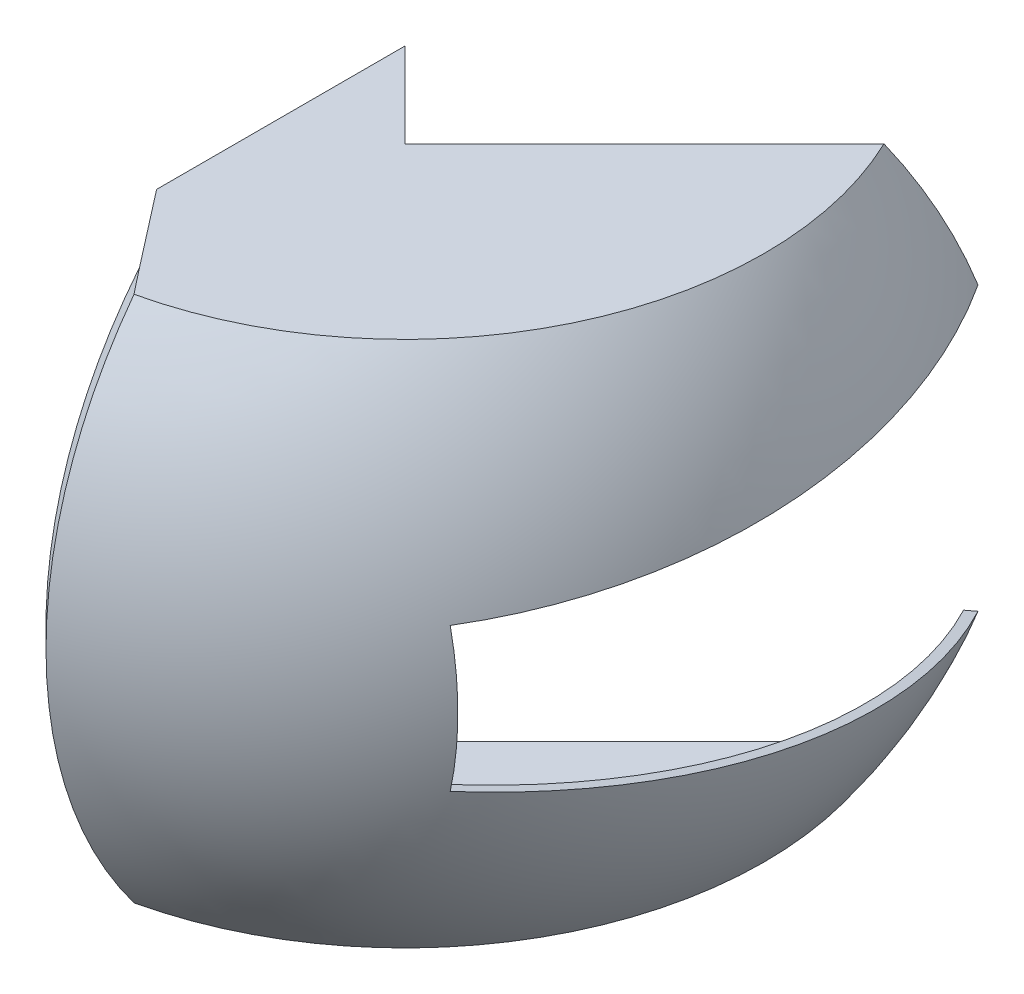
from build123d import *

# Parameters (mm, degrees)
OBR_T1_ANGLE                = 180
WYTNIJ_WYCI_GNI_CIE1_DEPTH  = 172.464281995
WYTNIJ_WYCI_GNI_CIE2_DEPTH  = 147.710676959
SFAZOWANIE1_SIZE            = 5
SKORUPA1_T                  = -2
DODANIE_WYCI_GNI_CIE1_DEPTH = 2


with BuildPart() as part:
    # Szkic1 → Obrót1 (revolve)
    with BuildSketch(Plane(origin=(0, 0, 0), x_dir=(0, 0, -1), z_dir=(1, 0, 0))):
        with BuildLine():
            Line((0, -55), (0, 55))
            Line((0, 55), (-75, 55))
            ThreePointArc((-75, 55), (-93.005376189, 0), (-75, -55))
            Line((-75, -55), (0, -55))
        make_face()
    revolve(axis=Axis((0, -55, 0), (0, 1, 0)), revolution_arc=OBR_T1_ANGLE)

    # Szkic2 → Wytnij-wyciągnięcie1 (cut, through all)
    with BuildSketch(Plane.XZ.offset(55)):
        Polygon((0, 0), (0, 40), (12.287280664, 48.603646545), (12.287280664, 99.487677337), (-26.065901524, 99.487677337), (-26.065901524, -104.75854766), (87.353699516, -104.75854766), (87.353699516, -51.998360457), (17.67766953, 17.67766953), align=None)
    extrude(amount=-WYTNIJ_WYCI_GNI_CIE1_DEPTH, mode=Mode.SUBTRACT)

    # Szkic3 → Wytnij-wyciągnięcie2 (cut, through all)
    with BuildSketch(Plane(origin=(100, 0, 0), x_dir=(0, 0, -1), z_dir=(1, 0, 0))):
        Polygon((-60, -15), (-60, 15), (45.666627767, 30), (45.666627767, -30), align=None)
    extrude(amount=-WYTNIJ_WYCI_GNI_CIE2_DEPTH, mode=Mode.SUBTRACT)

    # Sfazowanie1
    # the kernel refuses this chamfer: 5, 4.450979534 mm, written as the material it takes off along each edge
    with BuildSketch(Plane(origin=(12.287280664, 0, 0), x_dir=(0, 0.7023997796774998, 0.7117826560889214), z_dir=(0, 0.7117826560889214, -0.7023997796774998))) as sfazowanie1_piece_1:
        with BuildLine():
            Line((92.190144451 - SFAZOWANIE1_SIZE, 0), (91.510568486, 4.320424035))
            ThreePointArc((91.510568486, 4.320424035), (91.866596239, 2.222319448), (92.190144451, 0))
            Line((92.190144451, 0), (92.190144451 - SFAZOWANIE1_SIZE, 0))
        make_face()
    revolve(axis=Axis((12.287280664, 0, 0), (1, 0, 0)), revolution_arc=89.239714317, mode=Mode.SUBTRACT)

    # Skorupa1
    skorupa1_openings = [part.faces().sort_by_distance(p)[0] for p in [
        (0, 37.799975499, 20.551470825),
        (44.318791783, 39.564539913, -8.963452724),
        (12.287280664, 0, 66.554150501),
        (8.951756718, 38.623299359, 8.951756718),
        (6.176749303, 36.112578818, 44.325006424),
        (8.951756718, -38.623299359, 8.951756718),
        (44.318791783, -39.564539913, -8.963452724),
        (6.176749303, -36.112578818, 44.325006424),
        (0, -37.799975499, 20.551470825),
        (41.411625019, 0, 60),
        (50.400096072, -20.67683416, 20.009871862),
        (50.400096072, 20.67683416, 20.009871862),
    ]]
    offset(amount=SKORUPA1_T, openings=skorupa1_openings)

    # Szkic4 → Dodanie-wyciągnięcie1 (add)
    with BuildSketch(Plane.XZ.offset(55)):
        Polygon((0, 40), (0, 51.81910108), (12.287280664, 67.654425497), (12.287280664, 48.603646545), align=None)
    dodanie_wyci_gni_cie1 = extrude(amount=-DODANIE_WYCI_GNI_CIE1_DEPTH)

    # Lustro1: Dodanie-wyciągnięcie1 across plane
    add(dodanie_wyci_gni_cie1.mirror(Plane.ZX))


solid = part.part
